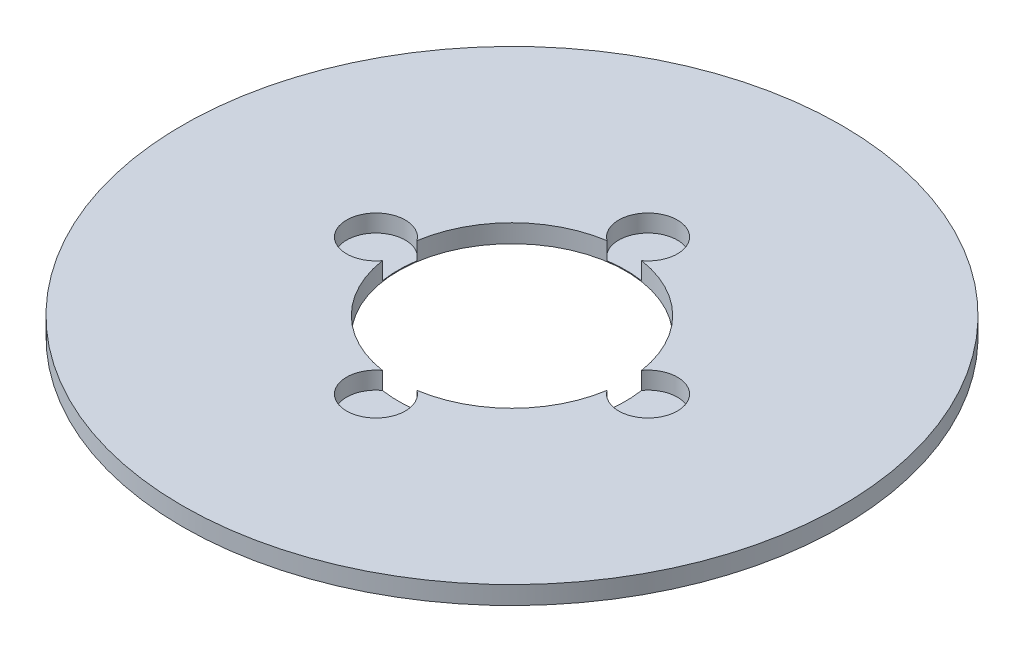
from build123d import *

# Parameters (mm, degrees)
SKETCH1_R           = 72.5
BOSS_EXTRUDE1_DEPTH = 4
SKETCH2_R           = 25
CUT_EXTRUDE1_DEPTH  = 103.608479182
SKETCH3_R           = 6.460335423
CUT_EXTRUDE2_DEPTH  = 3.826087221
CIRPATTERN1_COUNT   = 4


with BuildPart() as part:
    # Sketch1 → Boss-Extrude1 (new body)
    with BuildSketch(Plane(origin=(0, 0, 0), x_dir=(1, 0, 0), z_dir=(0, 1, 0))):
        Circle(SKETCH1_R)
    extrude(amount=BOSS_EXTRUDE1_DEPTH)

    # Sketch2 → Cut-Extrude1 (cut, through all)
    with BuildSketch(Plane(origin=(0, 0, 0), x_dir=(1, 0, 0), z_dir=(0, 1, 0))):
        Circle(SKETCH2_R)
    extrude(amount=CUT_EXTRUDE1_DEPTH, mode=Mode.SUBTRACT)

    # Sketch3 → Cut-Extrude2 (cut)
    with BuildSketch(Plane(origin=(0, 4, 0), x_dir=(1, 0, 0), z_dir=(0, 1, 0))):
        with Locations((-29.930514205, 0)):
            Circle(SKETCH3_R)
    cut_extrude2 = extrude(amount=-CUT_EXTRUDE2_DEPTH, mode=Mode.SUBTRACT)

    # CirPattern1: Cut-Extrude2 ×4 about axis
    cirpattern1_axis = Axis((0, 0, 0), (0, 1, 0))
    for i in range(1, CIRPATTERN1_COUNT):
        add(cut_extrude2.rotate(cirpattern1_axis, i * 360 / CIRPATTERN1_COUNT), mode=Mode.SUBTRACT)


solid = part.part
